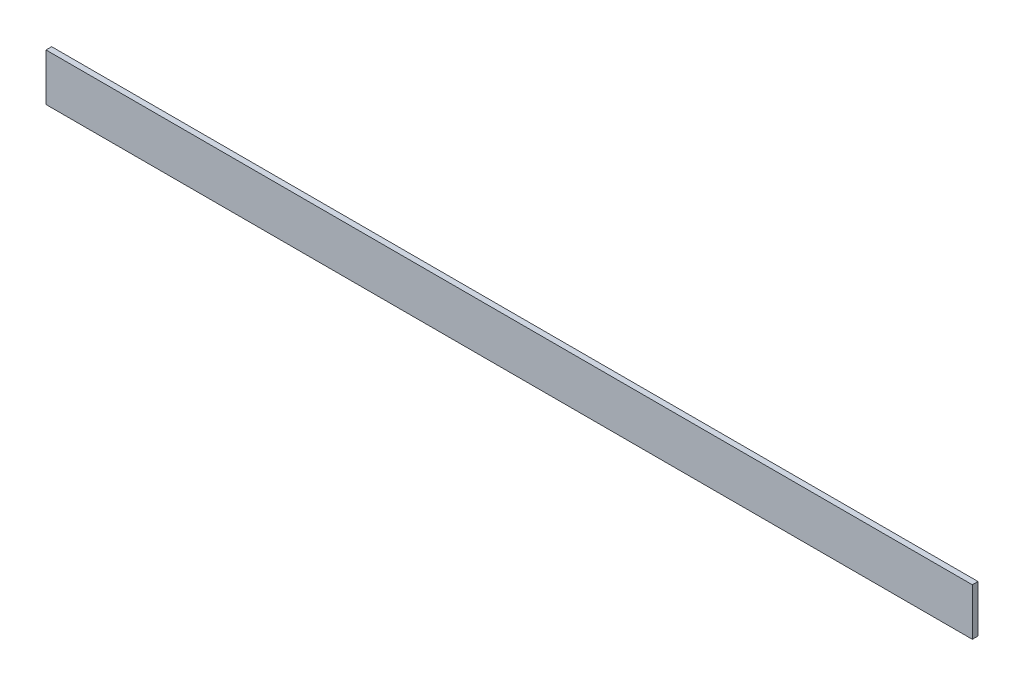
from build123d import *

# Parameters (mm, degrees)
EXTRUDE_1_DEPTH     = 490
SKETCH_2_W          = 22
SKETCH_2_H          = 22
CUT_EXTRUDE_1_DEPTH = 492.273854383


with BuildPart() as part:
    # Эскиз1 → Вытянуть-Тонкостенный1 (new body)
    with BuildSketch(Plane(origin=(0, 0, 0), x_dir=(0, 0, -1), z_dir=(1, 0, 0))):
        Polygon((0, 25), (0, 0), (25, 0), (25, 3), (3, 3), (3, 25), align=None)
    extrude(amount=EXTRUDE_1_DEPTH)

    # Эскиз2 → Вырез-Вытянуть1 (cut, through all)
    with BuildSketch(Plane.XZ):
        with Locations((11, -14)):
            Rectangle(SKETCH_2_W, SKETCH_2_H)
        with Locations((479, -14)):
            Rectangle(SKETCH_2_W, SKETCH_2_H)
    extrude(amount=-CUT_EXTRUDE_1_DEPTH, mode=Mode.SUBTRACT)


solid = part.part
